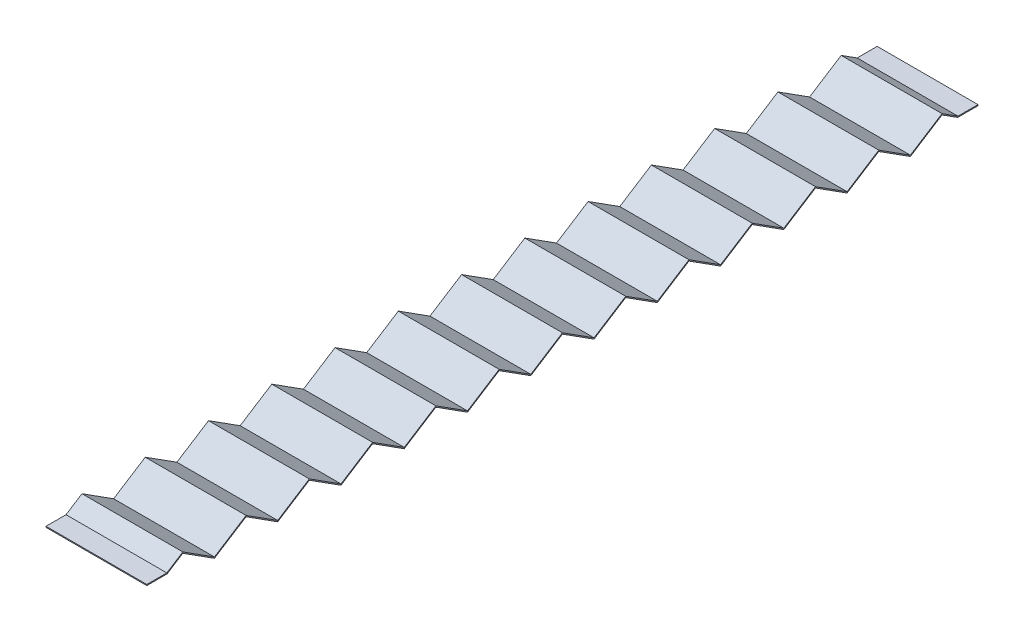
from build123d import *

# Parameters (mm, degrees)
EXTRUDE_THIN1_DEPTH = 25


with BuildPart() as part:
    # Sketch3 → Extrude-Thin1 (new, symmetric)
    with BuildSketch(Plane(origin=(0, 0, 0), x_dir=(0, 0, -1), z_dir=(1, 0, 0))):
        Polygon((0, 4.75), (10.072906287, 4.75), (17.843586069, 9.703524902), (33.530758208, -0.296475098), (49.217930346, 9.703524902), (64.905102485, -0.296475098), (80.592274623, 9.703524902), (96.279446762, -0.296475098), (111.9666189, 9.703524902), (127.653791038, -0.296475098), (143.340963177, 9.703524902), (159.028135315, -0.296475098), (174.715307454, 9.703524902), (190.402479592, -0.296475098), (206.089651731, 9.703524902), (221.776823869, -0.296475098), (237.463996008, 9.703524902), (253.151168146, -0.296475098), (268.838340285, 9.703524902), (284.525512423, -0.296475098), (300.212684561, 9.703524902), (315.8998567, -0.296475098), (331.587028838, 9.703524902), (347.274200977, -0.296475098), (362.961373115, 9.703524902), (378.648545254, -0.296475098), (394.335717392, 9.703524902), (402.106397175, 4.75), (412.179303461, 4.75), (412.179303461, 5.25), (402.252209748, 5.25), (394.335717392, 10.296475098), (378.648545254, 0.296475098), (362.961373115, 10.296475098), (347.274200977, 0.296475098), (331.587028838, 10.296475098), (315.8998567, 0.296475098), (300.212684561, 10.296475098), (284.525512423, 0.296475098), (268.838340285, 10.296475098), (253.151168146, 0.296475098), (237.463996008, 10.296475098), (221.776823869, 0.296475098), (206.089651731, 10.296475098), (190.402479592, 0.296475098), (174.715307454, 10.296475098), (159.028135315, 0.296475098), (143.340963177, 10.296475098), (127.653791038, 0.296475098), (111.9666189, 10.296475098), (96.279446762, 0.296475098), (80.592274623, 10.296475098), (64.905102485, 0.296475098), (49.217930346, 10.296475098), (33.530758208, 0.296475098), (17.843586069, 10.296475098), (9.927093713, 5.25), (0, 5.25), align=None)
    extrude(amount=EXTRUDE_THIN1_DEPTH, both=True)


solid = part.part
